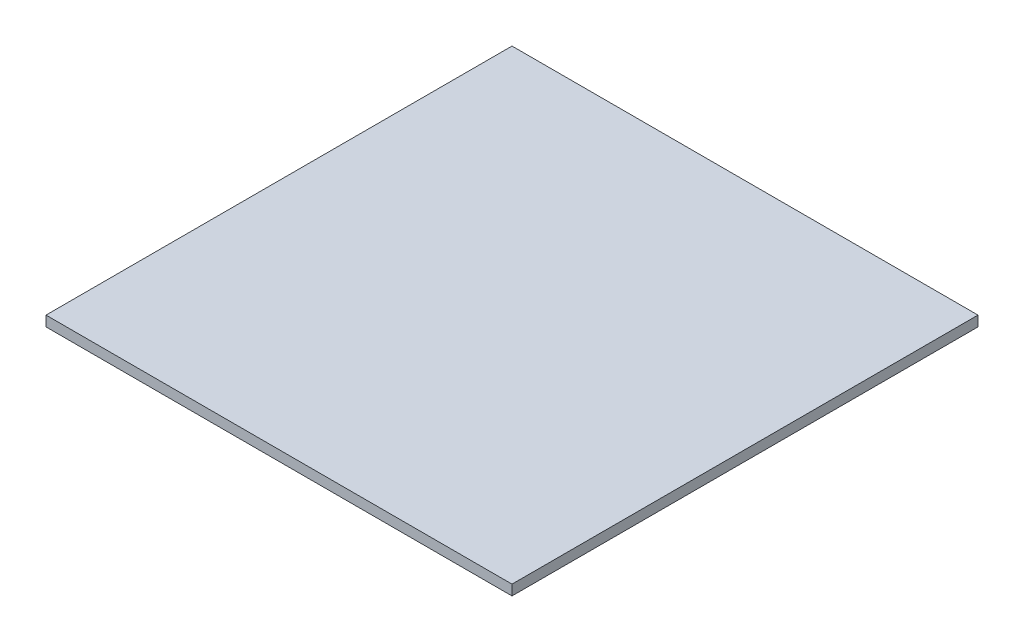
from build123d import *

# Parameters (mm, degrees)
SKETCH1_W           = 288.925
SKETCH1_H           = 288.925
BOSS_EXTRUDE1_DEPTH = 6.359632809


with BuildPart() as part:
    # Sketch1 → Boss-Extrude1 (new body)
    with BuildSketch(Plane(origin=(0, 0, 0), x_dir=(1, 0, 0), z_dir=(0, 1, 0))):
        Rectangle(SKETCH1_W, SKETCH1_H)
    extrude(amount=BOSS_EXTRUDE1_DEPTH)


solid = part.part
